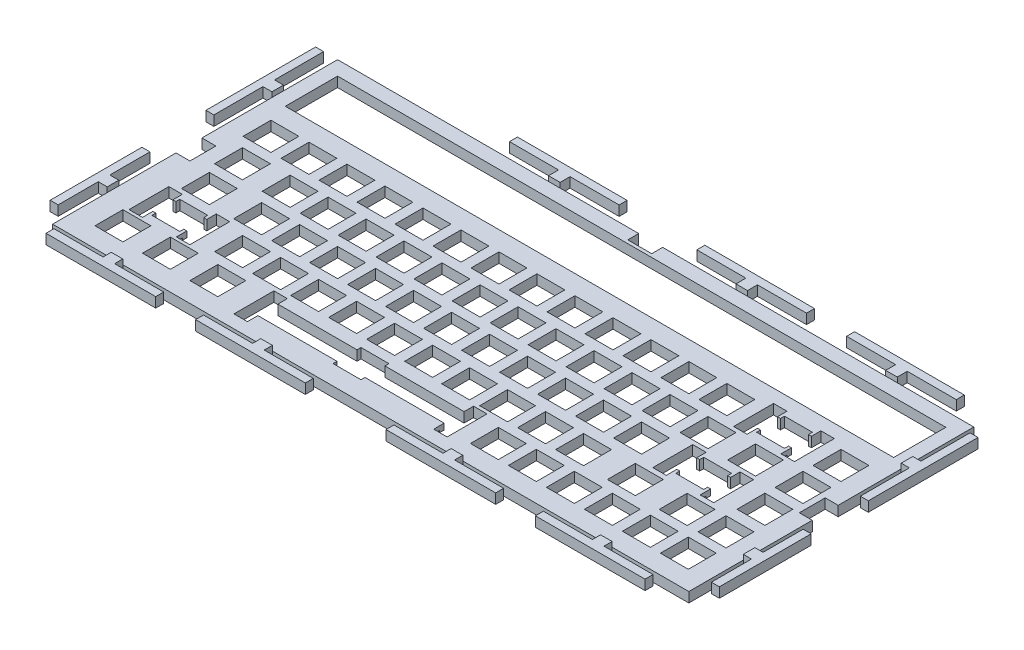
from build123d import *

# Parameters (mm, degrees)
SKETCH1_W           = 319
SKETCH1_H           = 142.875
SKETCH1_W_2         = 14
SKETCH1_H_2         = 14
SKETCH1_W_3         = 305
SKETCH1_H_3         = 26.2
BOSS_EXTRUDE2_DEPTH = 2.5
BOSS_EXTRUDE3_DEPTH = 2.5
SKETCH3_W           = 6.5
SKETCH3_H           = 13
SKETCH3_W_2         = 11.999287304
SKETCH3_H_2         = 5.5
SKETCH3_W_3         = 7
CUT_EXTRUDE1_DEPTH  = 246.814043286
CUT_EXTRUDE2_DEPTH  = 18
CUT_EXTRUDE3_DEPTH  = 18
CUT_EXTRUDE4_DEPTH  = 18
CUT_EXTRUDE5_DEPTH  = 95


with BuildPart() as part:
    # Sketch1 → Boss-Extrude2 (new, symmetric)
    with BuildSketch(Plane(origin=(0, 0, 0), x_dir=(1, 0, 0), z_dir=(0, 1, 0))):
        with Locations((55.078496059, 23.552072889)):
            Rectangle(SKETCH1_W, SKETCH1_H)
        with Locations((-68.754503941, 44.995572889)):
            Rectangle(SKETCH1_W_2, SKETCH1_H_2, mode=Mode.SUBTRACT)
        with Locations((-87.826503941, 44.995572889)):
            Rectangle(SKETCH1_W_2, SKETCH1_H_2, mode=Mode.SUBTRACT)
        with Locations((140.749496059, 44.995572889)):
            Rectangle(SKETCH1_W_2, SKETCH1_H_2, mode=Mode.SUBTRACT)
        with Locations((-30.654503941, 44.995572889)):
            Rectangle(SKETCH1_W_2, SKETCH1_H_2, mode=Mode.SUBTRACT)
        with Locations((-49.704503941, 44.995572889)):
            Rectangle(SKETCH1_W_2, SKETCH1_H_2, mode=Mode.SUBTRACT)
        with Locations((7.445496059, 44.995572889)):
            Rectangle(SKETCH1_W_2, SKETCH1_H_2, mode=Mode.SUBTRACT)
        with Locations((-11.604503941, 44.995572889)):
            Rectangle(SKETCH1_W_2, SKETCH1_H_2, mode=Mode.SUBTRACT)
        with Locations((45.545496059, 44.995572889)):
            Rectangle(SKETCH1_W_2, SKETCH1_H_2, mode=Mode.SUBTRACT)
        with Locations((26.495496059, 44.995572889)):
            Rectangle(SKETCH1_W_2, SKETCH1_H_2, mode=Mode.SUBTRACT)
        with Locations((174.183496059, 25.945572889)):
            Rectangle(SKETCH1_W_2, SKETCH1_H_2, mode=Mode.SUBTRACT)
        with Locations((83.645496059, 44.995572889)):
            Rectangle(SKETCH1_W_2, SKETCH1_H_2, mode=Mode.SUBTRACT)
        with Locations((64.595496059, 44.995572889)):
            Rectangle(SKETCH1_W_2, SKETCH1_H_2, mode=Mode.SUBTRACT)
        with Locations((121.722496059, 44.995572889)):
            Rectangle(SKETCH1_W_2, SKETCH1_H_2, mode=Mode.SUBTRACT)
        with Locations((102.695496059, 44.995572889)):
            Rectangle(SKETCH1_W_2, SKETCH1_H_2, mode=Mode.SUBTRACT)
        Polygon((162.399496059, 52.245572889), (176.399496059, 52.245572889), (176.399496059, 50.245572889), (177.899496059, 50.245572889), (177.899496059, 54.995572889), (184.649496059, 54.995572889), (184.649496059, 34.995572889), (177.899496059, 34.995572889), (177.899496059, 40.245572889), (176.399496059, 40.245572889), (176.399496059, 38.245572889), (162.399496059, 38.245572889), (162.399496059, 40.245572889), (160.899496059, 40.245572889), (160.899496059, 34.995572889), (154.149496059, 34.995572889), (154.149496059, 54.995572889), (160.899496059, 54.995572889), (160.899496059, 50.245572889), (162.399496059, 50.245572889), align=None, mode=Mode.SUBTRACT)
        with Locations((-40.126503941, 25.945572889)):
            Rectangle(SKETCH1_W_2, SKETCH1_H_2, mode=Mode.SUBTRACT)
        with Locations((-59.176503941, 25.945572889)):
            Rectangle(SKETCH1_W_2, SKETCH1_H_2, mode=Mode.SUBTRACT)
        with Locations((-2.051503941, 25.945572889)):
            Rectangle(SKETCH1_W_2, SKETCH1_H_2, mode=Mode.SUBTRACT)
        with Locations((-21.076503941, 25.945572889)):
            Rectangle(SKETCH1_W_2, SKETCH1_H_2, mode=Mode.SUBTRACT)
        with Locations((36.073496059, 25.945572889)):
            Rectangle(SKETCH1_W_2, SKETCH1_H_2, mode=Mode.SUBTRACT)
        with Locations((16.948496059, 25.945572889)):
            Rectangle(SKETCH1_W_2, SKETCH1_H_2, mode=Mode.SUBTRACT)
        with Locations((74.148496059, 25.945572889)):
            Rectangle(SKETCH1_W_2, SKETCH1_H_2, mode=Mode.SUBTRACT)
        with Locations((55.123496059, 25.945572889)):
            Rectangle(SKETCH1_W_2, SKETCH1_H_2, mode=Mode.SUBTRACT)
        Polygon((159.986496059, 14.145572889), (173.986496059, 14.145572889), (173.986496059, 12.145572889), (175.486496059, 12.145572889), (175.486496059, 16.895572889), (182.236496059, 16.895572889), (182.236496059, -3.104427111), (175.486496059, -3.104427111), (175.486496059, 2.145572889), (173.986496059, 2.145572889), (173.986496059, 0.145572889), (159.986496059, 0.145572889), (159.986496059, 2.145572889), (158.486496059, 2.145572889), (158.486496059, -3.104427111), (151.736496059, -3.104427111), (151.736496059, 16.895572889), (158.486496059, 16.895572889), (158.486496059, 12.145572889), (159.986496059, 12.145572889), align=None, mode=Mode.SUBTRACT)
        with Locations((-35.363503941, 6.895572889)):
            Rectangle(SKETCH1_W_2, SKETCH1_H_2, mode=Mode.SUBTRACT)
        with Locations((-54.413503941, 6.895572889)):
            Rectangle(SKETCH1_W_2, SKETCH1_H_2, mode=Mode.SUBTRACT)
        with Locations((112.273496059, 25.945572889)):
            Rectangle(SKETCH1_W_2, SKETCH1_H_2, mode=Mode.SUBTRACT)
        with Locations((93.223496059, 25.945572889)):
            Rectangle(SKETCH1_W_2, SKETCH1_H_2, mode=Mode.SUBTRACT)
        with Locations((-83.063503941, 25.945572889)):
            Rectangle(SKETCH1_W_2, SKETCH1_H_2, mode=Mode.SUBTRACT)
        with Locations((131.323496059, 25.945572889)):
            Rectangle(SKETCH1_W_2, SKETCH1_H_2, mode=Mode.SUBTRACT)
        with Locations((150.373496059, 25.945572889)):
            Rectangle(SKETCH1_W_2, SKETCH1_H_2, mode=Mode.SUBTRACT)
        with Locations((2.736496059, 6.895572889)):
            Rectangle(SKETCH1_W_2, SKETCH1_H_2, mode=Mode.SUBTRACT)
        with Locations((-16.313503941, 6.895572889)):
            Rectangle(SKETCH1_W_2, SKETCH1_H_2, mode=Mode.SUBTRACT)
        with Locations((40.836496059, 6.895572889)):
            Rectangle(SKETCH1_W_2, SKETCH1_H_2, mode=Mode.SUBTRACT)
        with Locations((21.786496059, 6.895572889)):
            Rectangle(SKETCH1_W_2, SKETCH1_H_2, mode=Mode.SUBTRACT)
        with Locations((78.936496059, 6.895572889)):
            Rectangle(SKETCH1_W_2, SKETCH1_H_2, mode=Mode.SUBTRACT)
        with Locations((59.886496059, 6.895572889)):
            Rectangle(SKETCH1_W_2, SKETCH1_H_2, mode=Mode.SUBTRACT)
        with Locations((117.036496059, 6.895572889)):
            Rectangle(SKETCH1_W_2, SKETCH1_H_2, mode=Mode.SUBTRACT)
        with Locations((97.986496059, 6.895572889)):
            Rectangle(SKETCH1_W_2, SKETCH1_H_2, mode=Mode.SUBTRACT)
        with Locations((-80.607503941, 6.895572889)):
            Rectangle(SKETCH1_W_2, SKETCH1_H_2, mode=Mode.SUBTRACT)
        with Locations((136.086496059, 6.895572889)):
            Rectangle(SKETCH1_W_2, SKETCH1_H_2, mode=Mode.SUBTRACT)
        with Locations((-25.838503941, -12.154427111)):
            Rectangle(SKETCH1_W_2, SKETCH1_H_2, mode=Mode.SUBTRACT)
        with Locations((-44.888503941, -12.154427111)):
            Rectangle(SKETCH1_W_2, SKETCH1_H_2, mode=Mode.SUBTRACT)
        with Locations((12.261496059, -12.154427111)):
            Rectangle(SKETCH1_W_2, SKETCH1_H_2, mode=Mode.SUBTRACT)
        with Locations((-6.788503941, -12.154427111)):
            Rectangle(SKETCH1_W_2, SKETCH1_H_2, mode=Mode.SUBTRACT)
        with Locations((50.361496059, -12.154427111)):
            Rectangle(SKETCH1_W_2, SKETCH1_H_2, mode=Mode.SUBTRACT)
        with Locations((31.311496059, -12.154427111)):
            Rectangle(SKETCH1_W_2, SKETCH1_H_2, mode=Mode.SUBTRACT)
        with Locations((88.461496059, -12.654427111)):
            Rectangle(SKETCH1_W_2, SKETCH1_H_2, mode=Mode.SUBTRACT)
        with Locations((69.411496059, -12.654427111)):
            Rectangle(SKETCH1_W_2, SKETCH1_H_2, mode=Mode.SUBTRACT)
        with Locations((126.561496059, -12.654427111)):
            Rectangle(SKETCH1_W_2, SKETCH1_H_2, mode=Mode.SUBTRACT)
        with Locations((107.511496059, -12.654427111)):
            Rectangle(SKETCH1_W_2, SKETCH1_H_2, mode=Mode.SUBTRACT)
        Polygon((-83.344503941, -5.154427111), (-69.344503941, -5.154427111), (-69.344503941, -7.154427111), (-67.844503941, -7.154427111), (-67.844503941, -2.404427111), (-61.094503941, -2.404427111), (-61.094503941, -22.404427111), (-67.844503941, -22.404427111), (-67.844503941, -17.154427111), (-69.344503941, -17.154427111), (-69.344503941, -19.154427111), (-83.344503941, -19.154427111), (-83.344503941, -17.154427111), (-84.844503941, -17.154427111), (-84.844503941, -22.404427111), (-91.594503941, -22.404427111), (-91.594503941, -2.404427111), (-84.844503941, -2.404427111), (-84.844503941, -7.154427111), (-83.344503941, -7.154427111), align=None, mode=Mode.SUBTRACT)
        with Locations((152.523496059, -12.654427111)):
            Rectangle(SKETCH1_W_2, SKETCH1_H_2, mode=Mode.SUBTRACT)
        with Locations((178.485496059, -12.654427111)):
            Rectangle(SKETCH1_W_2, SKETCH1_H_2, mode=Mode.SUBTRACT)
        with Locations((55.223496059, 74.745572889)):
            Rectangle(SKETCH1_W_3, SKETCH1_H_3, mode=Mode.SUBTRACT)
        with Locations((197.995496059, 25.945572889)):
            Rectangle(SKETCH1_W_2, SKETCH1_H_2, mode=Mode.SUBTRACT)
        with Locations((197.974496059, 44.995572889)):
            Rectangle(SKETCH1_W_2, SKETCH1_H_2, mode=Mode.SUBTRACT)
        with Locations((197.942496059, 6.895572889)):
            Rectangle(SKETCH1_W_2, SKETCH1_H_2, mode=Mode.SUBTRACT)
        with Locations((197.985496059, -12.654427111)):
            Rectangle(SKETCH1_W_2, SKETCH1_H_2, mode=Mode.SUBTRACT)
        with Locations((-86.094503941, -30.954427111)):
            Rectangle(SKETCH1_W_2, SKETCH1_H_2, mode=Mode.SUBTRACT)
        with Locations((-62.294503941, -30.954427111)):
            Rectangle(SKETCH1_W_2, SKETCH1_H_2, mode=Mode.SUBTRACT)
        with Locations((-38.494503941, -30.954427111)):
            Rectangle(SKETCH1_W_2, SKETCH1_H_2, mode=Mode.SUBTRACT)
        Polygon((26.439496059, -24.114427111), (40.439496059, -24.114427111), (40.439496059, -26.114427111), (80.123496059, -26.114427111), (80.123496059, -21.364427111), (86.873496059, -21.364427111), (86.873496059, -41.364427111), (80.123496059, -41.364427111), (80.123496059, -36.114427111), (40.439496059, -36.114427111), (40.439496059, -38.114427111), (26.439496059, -38.114427111), (26.439496059, -36.114427111), (-13.244503941, -36.114427111), (-13.244503941, -41.364427111), (-19.994503941, -41.364427111), (-19.994503941, -21.364427111), (-13.244503941, -21.364427111), (-13.244503941, -26.114427111), (26.439496059, -26.114427111), align=None, mode=Mode.SUBTRACT)
        with Locations((102.543496059, -31.364427111)):
            Rectangle(SKETCH1_W_2, SKETCH1_H_2, mode=Mode.SUBTRACT)
        with Locations((121.593496059, -31.364427111)):
            Rectangle(SKETCH1_W_2, SKETCH1_H_2, mode=Mode.SUBTRACT)
        with Locations((140.643496059, -31.364427111)):
            Rectangle(SKETCH1_W_2, SKETCH1_H_2, mode=Mode.SUBTRACT)
        with Locations((159.693496059, -31.364427111)):
            Rectangle(SKETCH1_W_2, SKETCH1_H_2, mode=Mode.SUBTRACT)
        with Locations((178.743496059, -31.364427111)):
            Rectangle(SKETCH1_W_2, SKETCH1_H_2, mode=Mode.SUBTRACT)
        with Locations((197.793496059, -31.364427111)):
            Rectangle(SKETCH1_W_2, SKETCH1_H_2, mode=Mode.SUBTRACT)
    extrude(amount=BOSS_EXTRUDE2_DEPTH, both=True)

    # Sketch2 → Boss-Extrude3 (add, symmetric)
    with BuildSketch(Plane(origin=(0, 2.5, 0), x_dir=(1, 0, 0), z_dir=(0, 1, 0))):
        Polygon((214.578496059, 64.389572889), (214.578496059, 58.589572889), (218.678496059, 58.589572889), (218.678496059, 33.989572889), (222.678496059, 33.989572889), (222.678496059, 88.989572889), (218.678496059, 88.989572889), (218.678496059, 64.389572889), align=None)
        Polygon((-104.421503941, 67.889572889), (-104.421503941, 62.089572889), (-108.921503941, 62.089572889), (-108.921503941, 37.489572889), (-112.921503941, 37.489572889), (-112.921503941, 92.489572889), (-108.921503941, 92.489572889), (-108.921503941, 67.889572889), align=None)
        Polygon((-104.421503941, -14.685427111), (-104.421503941, -20.485427111), (-108.921503941, -20.485427111), (-108.921503941, -40.585427111), (-112.921503941, -40.585427111), (-112.921503941, 5.414572889), (-108.921503941, 5.414572889), (-108.921503941, -14.685427111), align=None)
        Polygon((1.358496059, 94.989572889), (7.158496059, 94.989572889), (7.158496059, 99.989572889), (31.758496059, 99.989572889), (31.758496059, 103.989572889), (-23.241503941, 103.989572889), (-23.241503941, 99.989572889), (1.358496059, 99.989572889), align=None)
        Polygon((-75.021503941, -47.885427111), (-69.221503941, -47.885427111), (-69.221503941, -51.985427111), (-44.621503941, -51.985427111), (-44.621503941, -55.985427111), (-99.621503941, -55.985427111), (-99.621503941, -51.985427111), (-75.021503941, -51.985427111), align=None)
        Polygon((-0.021503941, -47.885427111), (5.778496059, -47.885427111), (5.778496059, -51.985427111), (30.378496059, -51.985427111), (30.378496059, -55.985427111), (-24.621503941, -55.985427111), (-24.621503941, -51.985427111), (-0.021503941, -51.985427111), align=None)
        Polygon((95.428496059, -47.885427111), (101.228496059, -47.885427111), (101.228496059, -51.985427111), (125.828496059, -51.985427111), (125.828496059, -55.985427111), (70.828496059, -55.985427111), (70.828496059, -51.985427111), (95.428496059, -51.985427111), align=None)
        Polygon((170.328496059, -47.885427111), (176.128496059, -47.885427111), (176.128496059, -51.985427111), (200.728496059, -51.985427111), (200.728496059, -55.985427111), (145.728496059, -55.985427111), (145.728496059, -51.985427111), (170.328496059, -51.985427111), align=None)
        Polygon((95.314498579, 94.989572889), (101.114498579, 94.989572889), (101.114498579, 99.989572889), (125.714498579, 99.989572889), (125.714498579, 103.989572889), (70.714498579, 103.989572889), (70.714498579, 99.989572889), (95.314498579, 99.989572889), align=None)
        Polygon((170.396631751, 94.989572889), (176.196631751, 94.989572889), (176.196631751, 99.989572889), (200.796631751, 99.989572889), (200.796631751, 103.989572889), (145.796631751, 103.989572889), (145.796631751, 99.989572889), (170.396631751, 99.989572889), align=None)
        Polygon((214.578496059, -14.785427111), (214.578496059, -20.585427111), (218.678496059, -20.585427111), (218.678496059, -40.685427111), (222.678496059, -40.685427111), (222.678496059, 5.314572889), (218.678496059, 5.314572889), (218.678496059, -14.785427111), align=None)
    extrude(amount=BOSS_EXTRUDE3_DEPTH, both=True)

    # Sketch3 → Cut-Extrude1 (cut, through all)
    with BuildSketch(Plane(origin=(0, 2.5, 0), x_dir=(1, 0, 0), z_dir=(0, 1, 0))):
        with Locations((211.328496059, 20.489572889)):
            Rectangle(SKETCH3_W, SKETCH3_H)
        with Locations((52.578852407, 92.239572889)):
            Rectangle(SKETCH3_W_2, SKETCH3_H_2)
        with Locations((-100.921503941, 20.489572889)):
            Rectangle(SKETCH3_W_3, SKETCH3_H)
    extrude(amount=-CUT_EXTRUDE1_DEPTH, mode=Mode.SUBTRACT)

    # Sketch4 → Cut-Extrude2 (cut)
    with BuildSketch(Plane(origin=(175.486496059, 0, 0), x_dir=(0, 0, -1), z_dir=(1, 0, 0))):
        Polygon((-3.104427111, -2.5), (-3.104427111, 0.5), (-0.104427111, 0.5), (-0.104427111, -0.5), (2.145572889, -0.5), (2.145572889, -2.5), align=None)
    extrude(amount=-CUT_EXTRUDE2_DEPTH, mode=Mode.SUBTRACT)

    # Sketch6 → Cut-Extrude3 (cut)
    with BuildSketch(Plane(origin=(177.899496059, 0, 0), x_dir=(0, 0, -1), z_dir=(1, 0, 0))):
        Polygon((34.995572889, -2.5), (34.995572889, 0.5), (37.995572889, 0.5), (37.995572889, -0.5), (40.245572889, -0.5), (40.245572889, -2.5), align=None)
    extrude(amount=-CUT_EXTRUDE3_DEPTH, mode=Mode.SUBTRACT)

    # Sketch7 → Cut-Extrude4 (cut)
    with BuildSketch(Plane(origin=(-67.844503941, 0, 0), x_dir=(0, 0, -1), z_dir=(1, 0, 0))):
        Polygon((-22.404427111, -2.5), (-22.404427111, 0.5), (-19.404427111, 0.5), (-19.404427111, -0.5), (-17.154427111, -0.5), (-17.154427111, -2.5), align=None)
    extrude(amount=-CUT_EXTRUDE4_DEPTH, mode=Mode.SUBTRACT)

    # Sketch8 → Cut-Extrude5 (cut)
    with BuildSketch(Plane(origin=(80.123496059, 0, 0), x_dir=(0, 0, -1), z_dir=(1, 0, 0))):
        Polygon((-41.364427111, -2.5), (-41.364427111, 0.5), (-38.364427111, 0.5), (-38.364427111, -0.5), (-36.114427111, -0.5), (-36.114427111, -2.5), align=None)
    extrude(amount=-CUT_EXTRUDE5_DEPTH, mode=Mode.SUBTRACT)


solid = part.part
